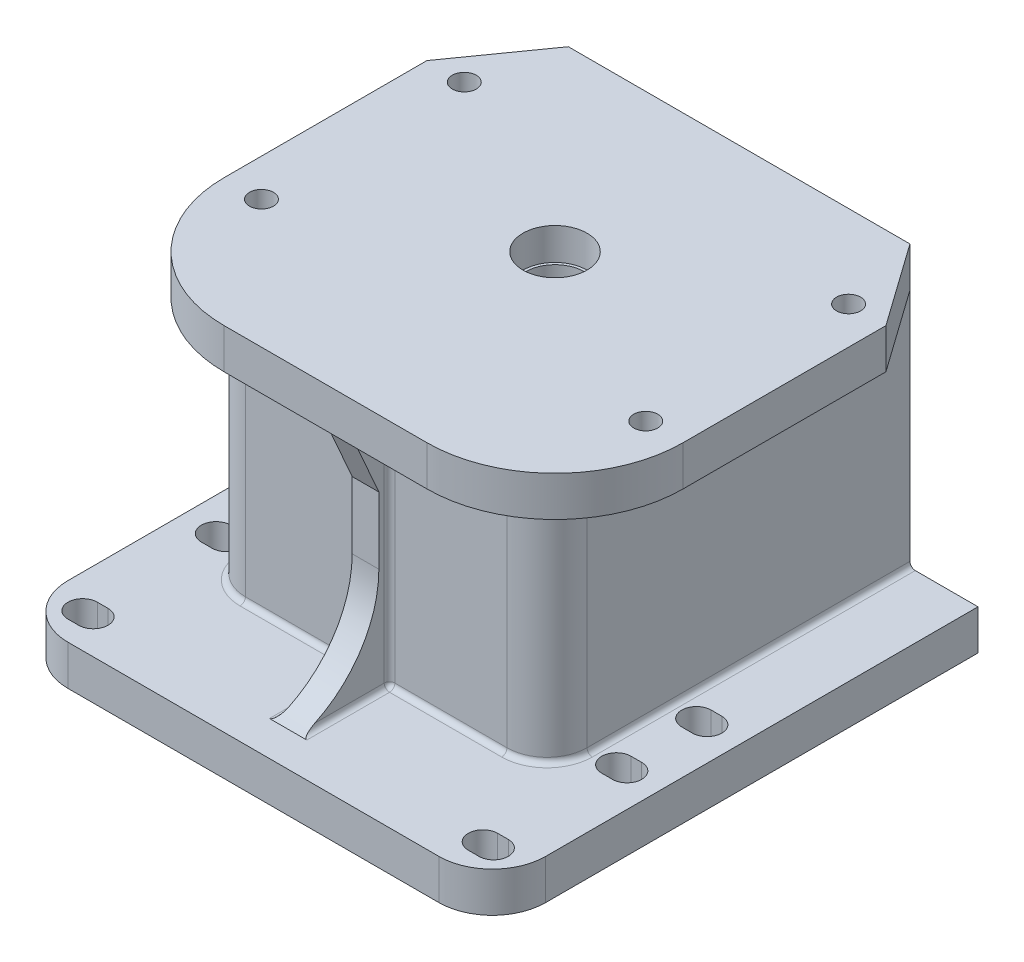
from build123d import *

# Parameters (mm, degrees)
SKETCH_1_W          = 179
SKETCH_1_H          = 182
EXTRUDE_1_DEPTH     = 15
SKETCH_2_R          = 15
CUT_EXTRUDE_1_DEPTH = 129.51556326
CUT_EXTRUDE_3_DEPTH = 129.51556326
FILLET_1_R          = 20
EXTRUDE_2_DEPTH     = 90
FILLET_2_R          = 15
EXTRUDE_3_DEPTH     = 5
SKETCH_7_W          = 172
SKETCH_7_H          = 155
EXTRUDE_4_DEPTH     = 15
CUT_EXTRUDE_4_DEPTH = 15
FILLET_3_R          = 48
SKETCH_9_R          = 4.5
CUT_EXTRUDE_5_DEPTH = 15
SKETCH_11_W         = 69
SKETCH_11_H         = 3
EXTRUDE_5_DEPTH     = 18
FILLET_4_R          = 18
SKETCH_12_R         = 12
CUT_EXTRUDE_6_DEPTH = 12
SKETCH_13_R         = 11
CUT_EXTRUDE_7_DEPTH = 6
FILLET_5_R          = 2


with BuildPart() as part:
    # 草图1 → 凸台-拉伸1 (new body)
    with BuildSketch(Plane(origin=(0, 0, 0), x_dir=(1, 0, 0), z_dir=(0, 1, 0))):
        Rectangle(SKETCH_1_W, SKETCH_1_H)
    extrude(amount=EXTRUDE_1_DEPTH)

    # 草图2 → 切除-拉伸1 (cut, through all)
    with BuildSketch(Plane(origin=(0, 15, 0), x_dir=(1, 0, 0), z_dir=(0, 1, 0))):
        with Locations(Location((0, 22, 0), (0, 0, 270))):
            Circle(SKETCH_2_R)
    extrude(amount=-CUT_EXTRUDE_1_DEPTH, mode=Mode.SUBTRACT)

    # 草图4 → 切除-拉伸3 (cut, through all)
    with BuildSketch(Plane(origin=(0, 15, 0), x_dir=(1, 0, 0), z_dir=(0, 1, 0))):
        with BuildLine():
            Line((-77, -72.5), (-73, -72.5))
            ThreePointArc((-73, -72.5), (-67.5, -78), (-73, -83.5))
            Line((-73, -83.5), (-77, -83.5))
            ThreePointArc((-77, -83.5), (-82.5, -78), (-77, -72.5))
        make_face()
        with BuildLine():
            Line((-77, -22.5), (-73, -22.5))
            ThreePointArc((-73, -22.5), (-67.5, -28), (-73, -33.5))
            Line((-73, -33.5), (-77, -33.5))
            ThreePointArc((-77, -33.5), (-82.5, -28), (-77, -22.5))
        make_face()
        with BuildLine():
            Line((-77, 7.5), (-73, 7.5))
            ThreePointArc((-73, 7.5), (-67.5, 2), (-73, -3.5))
            Line((-73, -3.5), (-77, -3.5))
            ThreePointArc((-77, -3.5), (-82.5, 2), (-77, 7.5))
        make_face()
        with BuildLine():
            Line((77, 7.5), (73, 7.5))
            ThreePointArc((73, 7.5), (67.5, 2), (73, -3.5))
            Line((73, -3.5), (77, -3.5))
            ThreePointArc((77, -3.5), (82.5, 2), (77, 7.5))
        make_face()
        with BuildLine():
            Line((77, -22.5), (73, -22.5))
            ThreePointArc((73, -22.5), (67.5, -28), (73, -33.5))
            Line((73, -33.5), (77, -33.5))
            ThreePointArc((77, -33.5), (82.5, -28), (77, -22.5))
        make_face()
        with BuildLine():
            Line((77, -72.5), (73, -72.5))
            ThreePointArc((73, -72.5), (67.5, -78), (73, -83.5))
            Line((73, -83.5), (77, -83.5))
            ThreePointArc((77, -83.5), (82.5, -78), (77, -72.5))
        make_face()
    extrude(amount=-CUT_EXTRUDE_3_DEPTH, mode=Mode.SUBTRACT)

    # 圆角1
    fillet_1_edges = [part.edges().sort_by_distance(p)[0] for p in [
        (89.5, 7.5, 91),
        (-89.5, 7.5, 91),
    ]]
    fillet(fillet_1_edges, radius=FILLET_1_R)

    # 草图5 → 凸台-拉伸2 (add)
    with BuildSketch(Plane(origin=(0, 15, 0), x_dir=(1, 0, 0), z_dir=(0, 1, 0))):
        Polygon((-64, 91), (-64, -45), (64, -45), (64, 91), (39, 91), (39, -29), (-39, -29), (-39, 91), align=None)
    extrude(amount=EXTRUDE_2_DEPTH)

    # 圆角2
    fillet_2_edges = [part.edges().sort_by_distance(p)[0] for p in [
        (-64, 60, 45),
        (64, 60, 45),
    ]]
    fillet(fillet_2_edges, radius=FILLET_2_R)

    # 草图6 → 凸台-拉伸3 (add, symmetric)
    with BuildSketch(Plane(origin=(0, 0, 0), x_dir=(0, 0, -1), z_dir=(1, 0, 0))):
        with BuildLine():
            Line((-45, 105), (-60, 105))
            Line((-60, 105), (-49, 80))
            Line((-49, 80), (-49, 54.937451095))
            ThreePointArc((-49, 54.937451095), (-57.014709064, 30.259525737), (-78, 15))
            Line((-78, 15), (-45, 15))
            Line((-45, 15), (-45, 105))
        make_face()
    extrude(amount=EXTRUDE_3_DEPTH, both=True)

    # 草图7 → 凸台-拉伸4 (add)
    with BuildSketch(Plane(origin=(0, 105, 0), x_dir=(1, 0, 0), z_dir=(0, 1, 0))):
        with Locations((0, 13.5)):
            Rectangle(SKETCH_7_W, SKETCH_7_H)
    extrude(amount=EXTRUDE_4_DEPTH)

    # 草图8 → 切除-拉伸4 (cut)
    with BuildSketch(Plane(origin=(0, 120, 0), x_dir=(1, 0, 0), z_dir=(0, 1, 0))):
        Polygon((-86, 91), (-86, 60), (-64, 91), align=None)
        Polygon((64, 91), (86, 91), (86, 60), align=None)
    extrude(amount=-CUT_EXTRUDE_4_DEPTH, mode=Mode.SUBTRACT)

    # 圆角3
    fillet_3_edges = [part.edges().sort_by_distance(p)[0] for p in [
        (-86, 112.5, 64),
        (86, 112.5, 64),
    ]]
    fillet(fillet_3_edges, radius=FILLET_3_R)

    # 草图9 → 切除-拉伸5 (cut)
    with BuildSketch(Plane(origin=(0, 120, 0), x_dir=(1, 0, 0), z_dir=(0, 1, 0))):
        with Locations(Location((-72, 60, 0), (0, 0, 270))):
            Circle(SKETCH_9_R)
        with Locations(Location((-72, -16, 0), (0, 0, 270))):
            Circle(SKETCH_9_R)
        with Locations(Location((72, -16, 0), (0, 0, 270))):
            Circle(SKETCH_9_R)
        with Locations(Location((72, 60, 0), (0, 0, 270))):
            Circle(SKETCH_9_R)
    extrude(amount=-CUT_EXTRUDE_5_DEPTH, mode=Mode.SUBTRACT)

    # 草图11 → 凸台-拉伸5 (add, symmetric)
    with BuildSketch(Plane(origin=(0, 0, 0), x_dir=(0, 0, -1), z_dir=(1, 0, 0))):
        with Locations((5.5, 103.5)):
            Rectangle(SKETCH_11_W, SKETCH_11_H)
    extrude(amount=EXTRUDE_5_DEPTH, both=True)

    # 圆角4
    fillet_4_edges = [part.edges().sort_by_distance(p)[0] for p in [
        (-18, 103.5, -40),
        (18, 103.5, -40),
    ]]
    fillet(fillet_4_edges, radius=FILLET_4_R - 0.0001)  # a hair under: the kernel refuses the full size

    # 草图12 → 切除-拉伸6 (cut)
    with BuildSketch(Plane(origin=(0, 120, 0), x_dir=(1, 0, 0), z_dir=(0, 1, 0))):
        with Locations(Location((0, 22, 0), (0, 0, 270))):
            Circle(SKETCH_12_R)
    extrude(amount=-CUT_EXTRUDE_6_DEPTH, mode=Mode.SUBTRACT)

    # 草图13 → 切除-拉伸7 (cut)
    with BuildSketch(Plane(origin=(0, 108, 0), x_dir=(1, 0, 0), z_dir=(0, 1, 0))):
        with Locations(Location((0, 22, 0), (0, 0, 270))):
            Circle(SKETCH_13_R)
    extrude(amount=-CUT_EXTRUDE_7_DEPTH, mode=Mode.SUBTRACT)

    # 圆角5
    fillet_5_edges = [part.edges().sort_by_distance(p)[0] for p in [
        (-64, 15, -30.5),
        (64, 15, -30.5),
        (-27, 15, 45),
        (59.606601718, 15, 40.606601718),
        (-59.606601718, 15, 40.606601718),
        (27, 15, 45),
        (-5, 60, 45),
        (-5, 105, 52.5),
        (-5, 15, 61.5),
        (5, 60, 45),
        (5, 105, 52.5),
        (5, 15, 61.5),
    ]]
    fillet(fillet_5_edges, radius=FILLET_5_R)


solid = part.part
